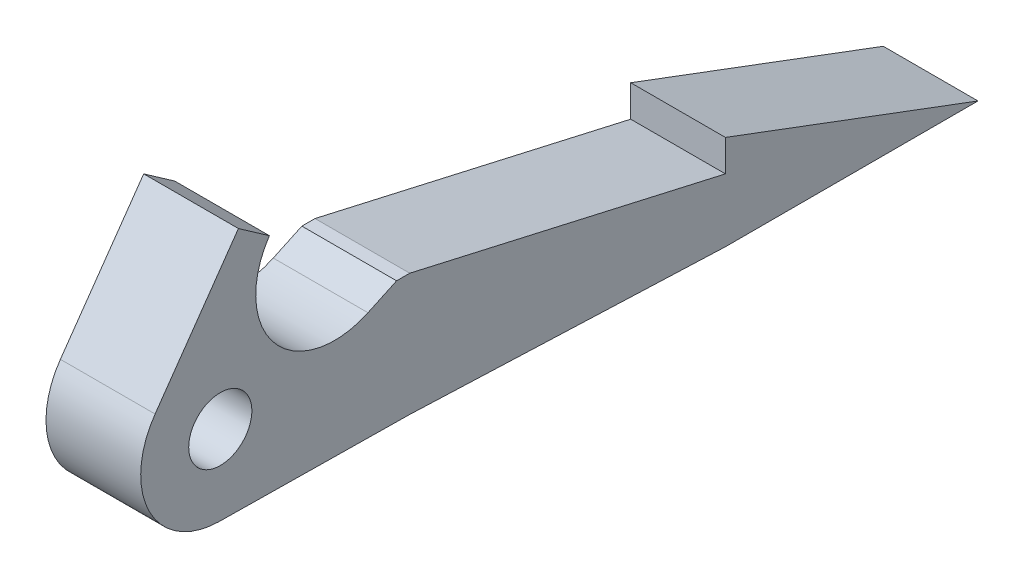
from build123d import *

# Parameters (mm, degrees)
STOCK_HAMMERSAW_START                 = -4.7625
STOCK_HAMMERSAW_MULTIBODY_1_OUTLINE_R = 3.175
STOCK_HAMMERSAW_MULTIBODY_1_DEPTH     = 9.525
BOSS_EXTRUDE3_DEPTH                   = 9.525


# Read off the part's stored shape, not the designer's step: Stock-HammerSaw Multibody-1
with BuildPart() as part:
    # Stock-HammerSaw Multibody-1 outline → Stock-HammerSaw Multibody-1 (new body)
    with BuildSketch(Plane.YZ.offset(STOCK_HAMMERSAW_START)):
        with BuildLine():
            ThreePointArc((14.114185067, -169.917610968), (5.877809274, -169.350270146), (1.524707151, -176.365272906))
            Line((1.524707151, -176.365272906), (1.27, -195.521646474))
            Line((1.27, -195.521646474), (13.572128535, -195.521646474))
            Line((13.572128535, -195.521646474), (13.572128535, -194.202498844))
            Line((13.572128535, -194.202498844), (12.230315554, -191.32497162))
            ThreePointArc((12.230315554, -191.32497162), (14.283881996, -181.92450591), (23.892574452, -181.415664109))
            Line((23.892574452, -181.415664109), (26.077900674, -178.294694821))
            Line((26.077900674, -178.294694821), (14.114185067, -169.917610968))
        make_face()
        with Locations((9.525, -176.471646474)):
            Circle(STOCK_HAMMERSAW_MULTIBODY_1_OUTLINE_R, mode=Mode.SUBTRACT)
    extrude(amount=STOCK_HAMMERSAW_MULTIBODY_1_DEPTH)

    # Sketch3 → Boss-Extrude3 (add)
    with BuildSketch(Plane(origin=(4.7625, 0, 0), x_dir=(0, 0, -1), z_dir=(1, 0, 0))):
        Polygon((195.521646474, 13.572128535), (227.271646474, 6.35), (227.271646474, 9.525), (252.671646474, 0), (227.271646474, 0), (195.521646474, 1.27), align=None)
    extrude(amount=-BOSS_EXTRUDE3_DEPTH)


solid = part.part
